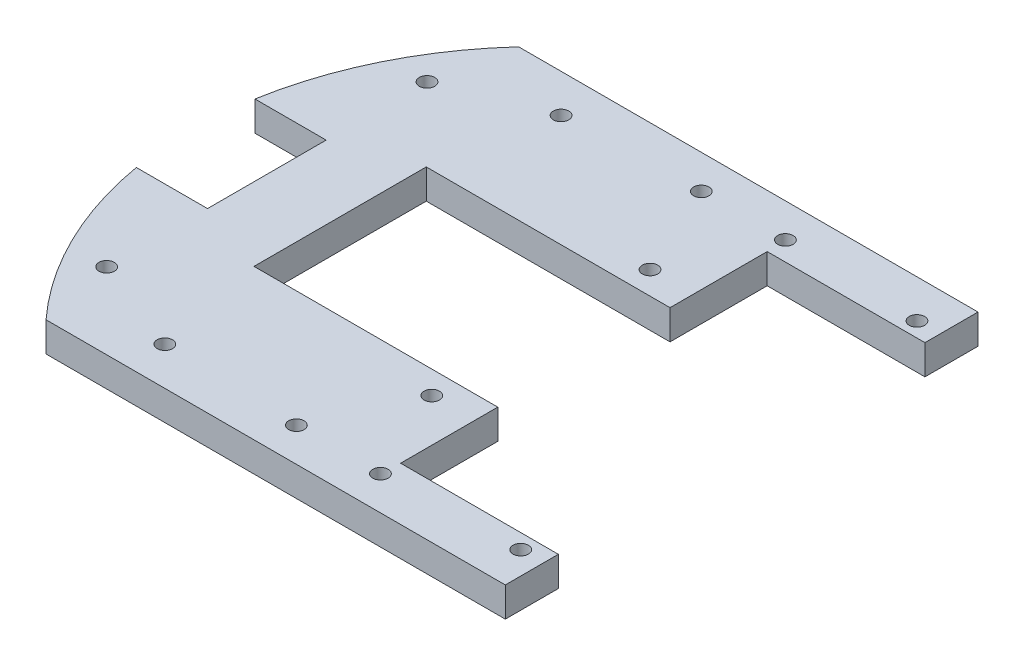
from build123d import *

# Parameters (mm, degrees)
SKETCH1_R           = 1.651
BOSS_EXTRUDE1_DEPTH = 6.35


with BuildPart() as part:
    # Sketch1 → Boss-Extrude1 (new body)
    with BuildSketch(Plane(origin=(0, 0, 0), x_dir=(1, 0, 0), z_dir=(0, 1, 0))):
        with BuildLine():
            Line((33.776652136, 7.168881649), (0, 7.168881649))
            Line((0, 7.168881649), (0, 44.052727236))
            Line((0, 44.052727236), (33.776652136, 44.052727236))
            Line((33.776652136, 44.052727236), (52.191652136, 44.052727236))
            Line((52.191652136, 44.052727236), (52.191652136, 64.853804442))
            Line((52.191652136, 64.853804442), (85.968304273, 64.853804442))
            Line((85.968304273, 64.853804442), (85.968304273, 76.214266248))
            Line((85.968304273, 76.214266248), (0, 76.214266248))
            Line((0, 76.214266248), (-12.371874213, 76.214266248))
            ThreePointArc((-12.371874213, 76.214266248), (-24.373410945, 58.595023332), (-30.932760678, 38.310804442))
            Line((-30.932760678, 38.310804442), (-15.692760678, 38.310804442))
            Line((-15.692760678, 38.310804442), (-15.692760678, 12.910804442))
            Line((-15.692760678, 12.910804442), (-30.932760678, 12.910804442))
            ThreePointArc((-30.932760678, 12.910804442), (-24.373410945, -7.373414447), (-12.371874213, -24.992657364))
            Line((-12.371874213, -24.992657364), (0, -24.992657364))
            Line((0, -24.992657364), (85.968304273, -24.992657364))
            Line((85.968304273, -24.992657364), (85.968304273, -13.632195558))
            Line((85.968304273, -13.632195558), (52.191652136, -13.632195558))
            Line((52.191652136, -13.632195558), (52.191652136, 7.168881649))
            Line((52.191652136, 7.168881649), (33.776652136, 7.168881649))
        make_face()
        with Locations((4.884152136, -16.807195558)):
            Circle(SKETCH1_R, mode=Mode.SUBTRACT)
        with Locations((81.084152136, -16.807195558)):
            Circle(SKETCH1_R, mode=Mode.SUBTRACT)
        with Locations((42.984152136, 2.242804442)):
            Circle(SKETCH1_R, mode=Mode.SUBTRACT)
        with Locations((33.983402136, -17.742657364)):
            Circle(SKETCH1_R, mode=Mode.SUBTRACT)
        with Locations((51.983402136, -17.742657364)):
            Circle(SKETCH1_R, mode=Mode.SUBTRACT)
        with Locations((51.983402136, 68.964266248)):
            Circle(SKETCH1_R, mode=Mode.SUBTRACT)
        with Locations((33.983402136, 68.964266248)):
            Circle(SKETCH1_R, mode=Mode.SUBTRACT)
        with Locations((42.984152136, 48.978804442)):
            Circle(SKETCH1_R, mode=Mode.SUBTRACT)
        with Locations((81.084152136, 68.028804442)):
            Circle(SKETCH1_R, mode=Mode.SUBTRACT)
        with Locations((4.884152136, 68.028804442)):
            Circle(SKETCH1_R, mode=Mode.SUBTRACT)
        with Locations((-15.692760678, 59.900804442)):
            Circle(SKETCH1_R, mode=Mode.SUBTRACT)
        with Locations((-15.692760678, -8.679195558)):
            Circle(SKETCH1_R, mode=Mode.SUBTRACT)
    extrude(amount=BOSS_EXTRUDE1_DEPTH)


solid = part.part
